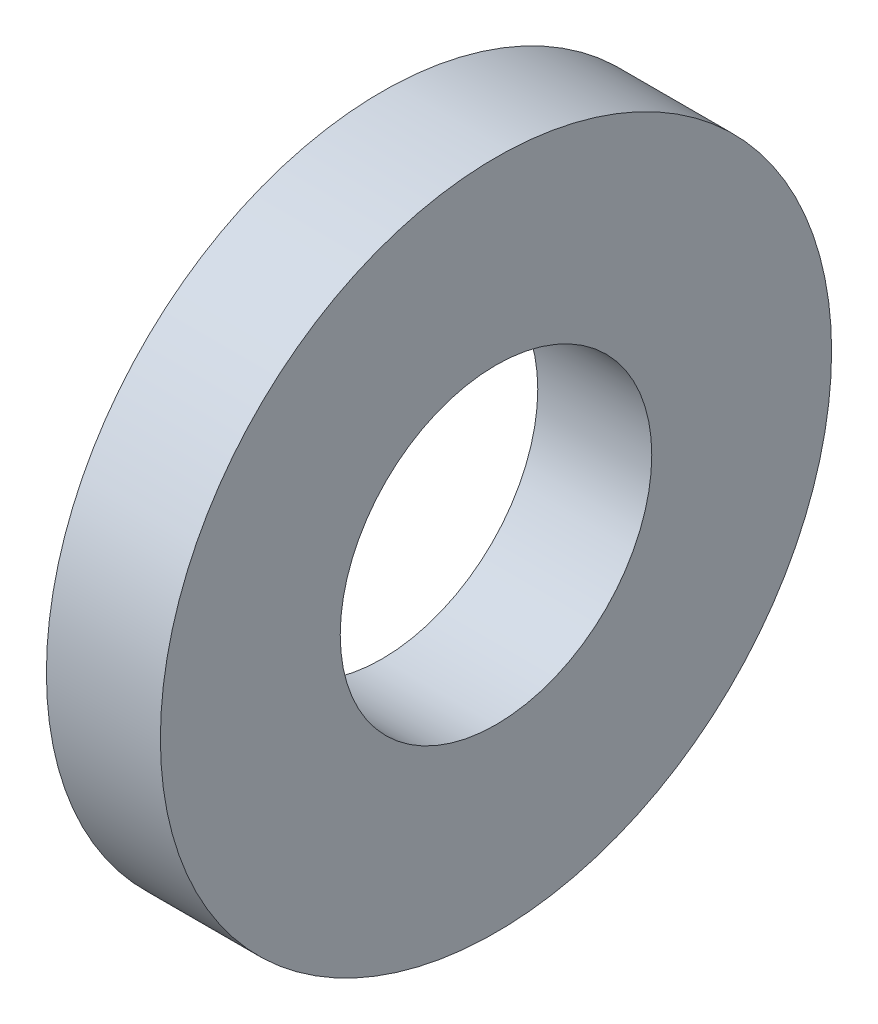
from build123d import *

# Parameters (mm, degrees)
SKETCH_1_R             = 8.833333333
SKETCH_1_R_2           = 4.1
SM_BASE_FLANGE_1_DEPTH = 3


# Sheet-metal steps are written as plain solids
with BuildPart() as part:
    # Sketch 1 → Базовая кромка1 (new body)
    with BuildSketch(Plane(origin=(0, 0, 0), x_dir=(0, 0, -1), z_dir=(1, 0, 0))):
        Circle(SKETCH_1_R)
        Circle(SKETCH_1_R_2, mode=Mode.SUBTRACT)
    extrude(amount=-SM_BASE_FLANGE_1_DEPTH)


solid = part.part
